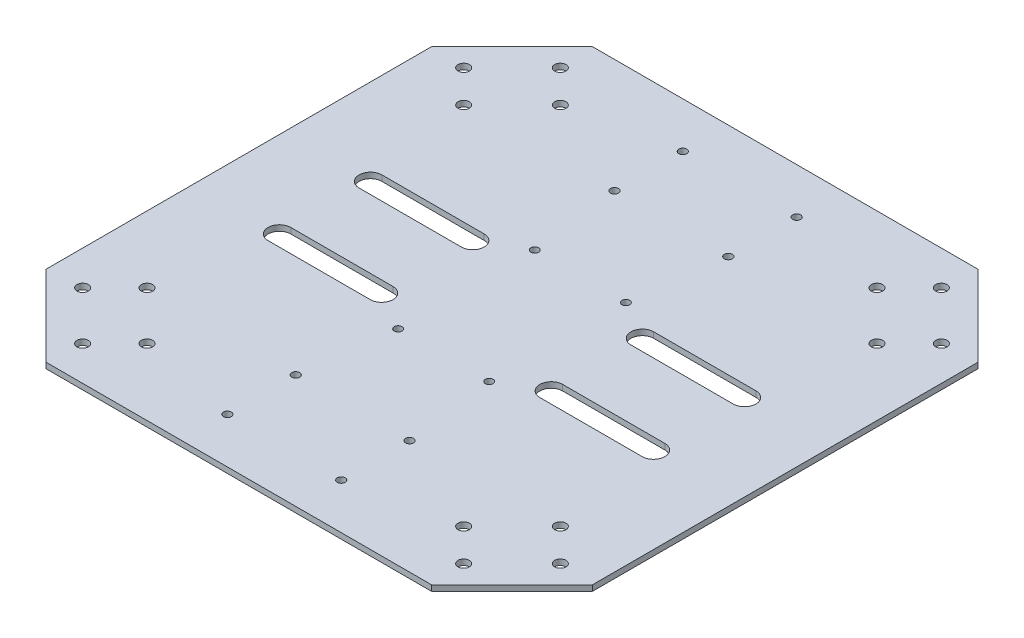
from build123d import *

# Parameters (mm, degrees)
BOSS_EXTRUDE1_DEPTH = 3.175
SKETCH2_R           = 3.175
CUT_EXTRUDE1_DEPTH  = 6.35
SKETCH3_R           = 2.159
CUT_EXTRUDE2_DEPTH  = 6.35
SKETCH4_R           = 2.2225
CUT_EXTRUDE3_DEPTH  = 351.937720963


with BuildPart() as part:
    # Sketch1 → Boss-Extrude1 (new body)
    with BuildSketch(Plane(origin=(0, 0, 0), x_dir=(1, 0, 0), z_dir=(0, 1, 0))):
        Polygon((-16.864769233, 51.656360067), (-61.766049839, 6.755079462), (-61.766049839, -208.242359328), (-16.864769233, -253.143639933), (198.132669556, -253.143639933), (243.033950161, -208.242359328), (243.033950161, 6.755079462), (198.132669556, 51.656360067), align=None)
        with BuildLine():
            ThreePointArc((43.337601054, -119.793639933), (49.687601054, -126.143639933), (43.337601054, -132.493639933))
            Line((43.337601054, -132.493639933), (-13.679235779, -132.493639933))
            ThreePointArc((-13.679235779, -132.493639933), (-20.029235779, -126.143639933), (-13.679235779, -119.793639933))
            Line((-13.679235779, -119.793639933), (43.337601054, -119.793639933))
        make_face(mode=Mode.SUBTRACT)
        with BuildLine():
            Line((194.947136102, -132.493639933), (137.930299269, -132.493639933))
            ThreePointArc((137.930299269, -132.493639933), (131.580299269, -126.143639933), (137.930299269, -119.793639933))
            Line((137.930299269, -119.793639933), (194.947136102, -119.793639933))
            ThreePointArc((194.947136102, -119.793639933), (201.297136102, -126.143639933), (194.947136102, -132.493639933))
        make_face(mode=Mode.SUBTRACT)
        with BuildLine():
            Line((-13.679235779, -68.993639933), (43.337601054, -68.993639933))
            ThreePointArc((43.337601054, -68.993639933), (49.687601054, -75.343639933), (43.337601054, -81.693639933))
            Line((43.337601054, -81.693639933), (-13.679235779, -81.693639933))
            ThreePointArc((-13.679235779, -81.693639933), (-20.029235779, -75.343639933), (-13.679235779, -68.993639933))
        make_face(mode=Mode.SUBTRACT)
        with BuildLine():
            ThreePointArc((137.930299269, -81.693639933), (131.580299269, -75.343639933), (137.930299269, -68.993639933))
            Line((137.930299269, -68.993639933), (194.947136102, -68.993639933))
            ThreePointArc((194.947136102, -68.993639933), (201.297136102, -75.343639933), (194.947136102, -81.693639933))
            Line((194.947136102, -81.693639933), (137.930299269, -81.693639933))
        make_face(mode=Mode.SUBTRACT)
    extrude(amount=BOSS_EXTRUDE1_DEPTH)

    # Sketch2 → Cut-Extrude1 (cut)
    with BuildSketch(Plane(origin=(0, 3.175, 0), x_dir=(1, 0, 0), z_dir=(0, 1, 0))):
        with Locations((-15.627316695, 32.458395287)):
            Circle(SKETCH2_R)
        with Locations((2.333195547, 14.497883045)):
            Circle(SKETCH2_R)
        with Locations((-24.607572816, -12.442885319)):
            Circle(SKETCH2_R)
        with Locations((-42.568085059, 5.517626924)):
            Circle(SKETCH2_R)
        with Locations((205.875473139, -12.442885319)):
            Circle(SKETCH2_R)
        with Locations((223.835985381, 5.517626924)):
            Circle(SKETCH2_R)
        with Locations((178.934704776, 14.497883045)):
            Circle(SKETCH2_R)
        with Locations((196.895217018, 32.458395287)):
            Circle(SKETCH2_R)
        with Locations((-24.607572816, -189.044394548)):
            Circle(SKETCH2_R)
        with Locations((-42.568085059, -207.00490679)):
            Circle(SKETCH2_R)
        with Locations((-15.627316695, -233.945675153)):
            Circle(SKETCH2_R)
        with Locations((2.333195547, -215.985162911)):
            Circle(SKETCH2_R)
        with Locations((223.835985381, -207.00490679)):
            Circle(SKETCH2_R)
        with Locations((196.895217018, -233.945675153)):
            Circle(SKETCH2_R)
        with Locations((178.934704776, -215.985162911)):
            Circle(SKETCH2_R)
        with Locations((205.875473139, -189.044394548)):
            Circle(SKETCH2_R)
    extrude(amount=-CUT_EXTRUDE1_DEPTH, mode=Mode.SUBTRACT)

    # Sketch3 → Cut-Extrude2 (cut)
    with BuildSketch(Plane(origin=(0, 3.175, 0), x_dir=(1, 0, 0), z_dir=(0, 1, 0))):
        with Locations((65.233950161, -62.643639933)):
            Circle(SKETCH3_R)
        with Locations((116.033950161, -62.643639933)):
            Circle(SKETCH3_R)
        with Locations((65.233950161, -138.843639933)):
            Circle(SKETCH3_R)
        with Locations((116.033950161, -138.843639933)):
            Circle(SKETCH3_R)
    extrude(amount=-CUT_EXTRUDE2_DEPTH, mode=Mode.SUBTRACT)

    # Sketch4 → Cut-Extrude3 (cut, through all)
    with BuildSketch(Plane(origin=(0, 3.175, 0), x_dir=(1, 0, 0), z_dir=(0, 1, 0))):
        with Locations((58.883950161, 26.256360067)):
            Circle(SKETCH4_R)
        with Locations((122.383950161, 26.256360067)):
            Circle(SKETCH4_R)
        with Locations((58.883950161, -11.843639933)):
            Circle(SKETCH4_R)
        with Locations((122.383950161, -11.843639933)):
            Circle(SKETCH4_R)
        with Locations((122.383950161, -189.643639933)):
            Circle(SKETCH4_R)
        with Locations((58.883950161, -189.643639933)):
            Circle(SKETCH4_R)
        with Locations((122.383950161, -227.743639933)):
            Circle(SKETCH4_R)
        with Locations((58.883950161, -227.743639933)):
            Circle(SKETCH4_R)
    extrude(amount=-CUT_EXTRUDE3_DEPTH, mode=Mode.SUBTRACT)


solid = part.part
